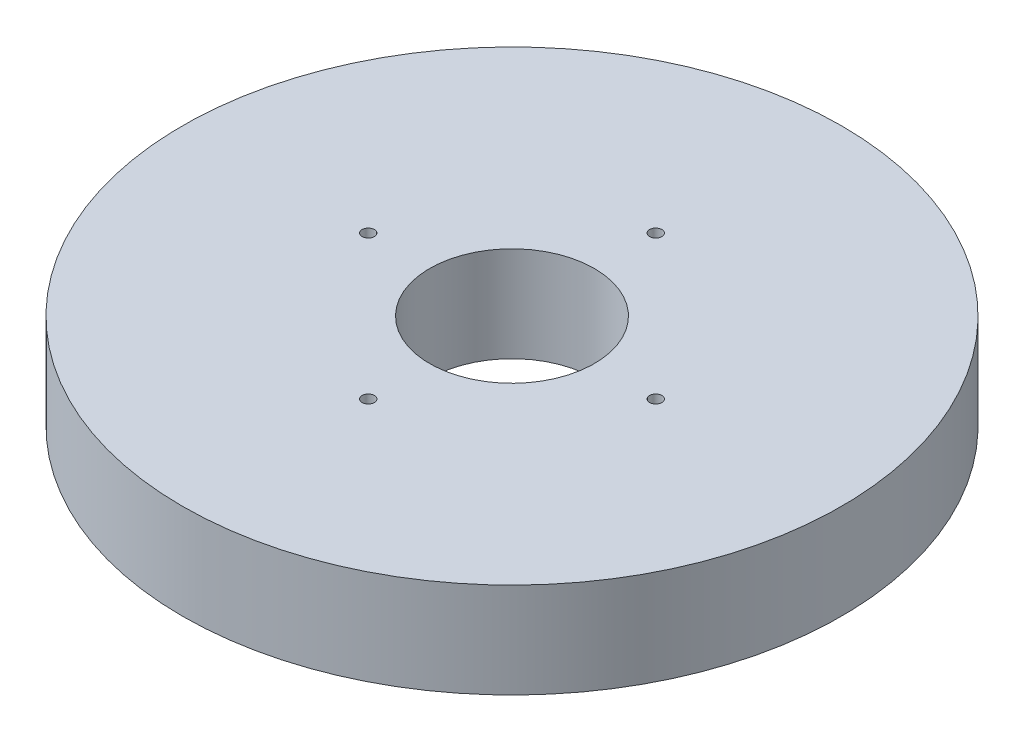
from build123d import *

# Parameters (mm, degrees)
SKETCH1_R           = 90
BOSS_EXTRUDE1_DEPTH = 26
SKETCH2_R           = 22.5
CUT_EXTRUDE1_DEPTH  = 130.907659512
SKETCH3_R           = 1.67783378
CUT_EXTRUDE2_DEPTH  = 18.435490804
CIRPATTERN1_COUNT   = 4


with BuildPart() as part:
    # Sketch1 → Boss-Extrude1 (new body)
    with BuildSketch(Plane(origin=(0, 0, 0), x_dir=(1, 0, 0), z_dir=(0, 1, 0))):
        Circle(SKETCH1_R)
    extrude(amount=BOSS_EXTRUDE1_DEPTH)

    # Sketch2 → Cut-Extrude1 (cut, through all)
    with BuildSketch(Plane(origin=(0, 0, 0), x_dir=(1, 0, 0), z_dir=(0, 1, 0))):
        Circle(SKETCH2_R)
    extrude(amount=CUT_EXTRUDE1_DEPTH, mode=Mode.SUBTRACT)

    # Sketch3 → Cut-Extrude2 (cut)
    with BuildSketch(Plane(origin=(0, 26, 0), x_dir=(1, 0, 0), z_dir=(0, 1, 0))):
        with Locations((-39.251291853, 0)):
            Circle(SKETCH3_R)
    cut_extrude2 = extrude(amount=-CUT_EXTRUDE2_DEPTH, mode=Mode.SUBTRACT)

    # CirPattern1: Cut-Extrude2 ×4 about axis
    cirpattern1_axis = Axis((0, 0, 0), (0, 1, 0))
    for i in range(1, CIRPATTERN1_COUNT):
        add(cut_extrude2.rotate(cirpattern1_axis, i * 360 / CIRPATTERN1_COUNT), mode=Mode.SUBTRACT)


solid = part.part
